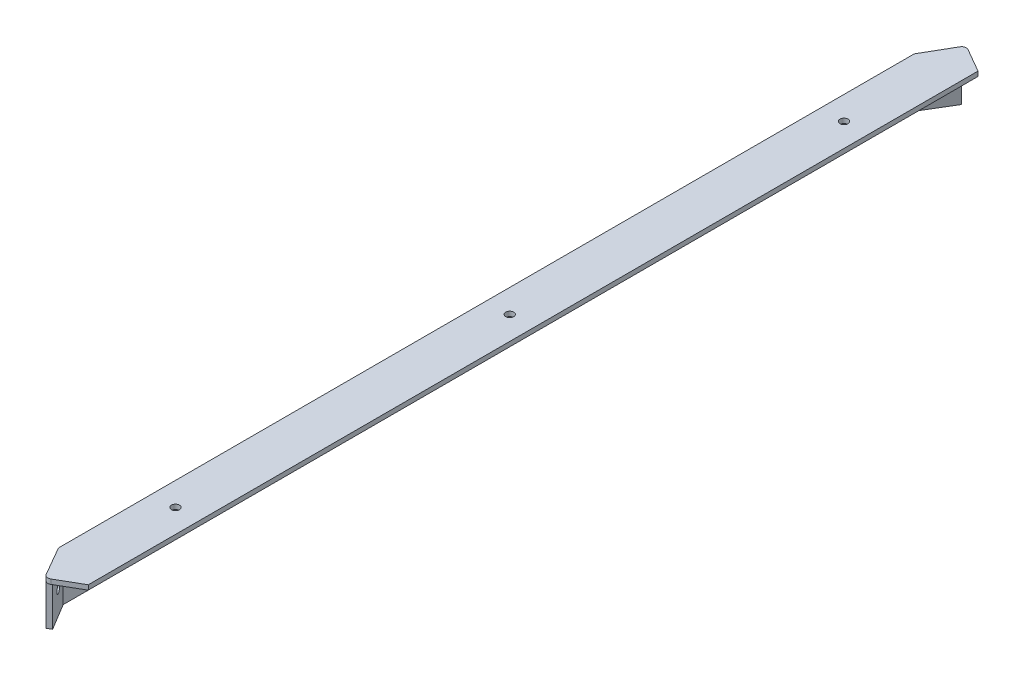
from build123d import *

# Parameters (mm, degrees)
BOSS_EXTRUDE1_DEPTH = 640
BOSS_EXTRUDE2_DEPTH = 63
BOSS_EXTRUDE4_DEPTH = 7
SKETCH10_R          = 6
CUT_EXTRUDE3_DEPTH  = 7
FILLET5_R           = 5
SKETCH22_R          = 6
CUT_EXTRUDE4_DEPTH  = 10


with BuildPart() as part:
    # Sketch1 → Boss-Extrude1 (new body)
    with BuildSketch(Plane.XY):
        Polygon((0, 0), (0, 70), (70, 70), (70, 63), (7, 63), (7, 0), align=None)
    extrude(amount=BOSS_EXTRUDE1_DEPTH)

    # Sketch2 → Boss-Extrude2 (add)
    with BuildSketch(Plane(origin=(0, 0, 0), x_dir=(1, 0, 0), z_dir=(0, 1, 0))):
        Polygon((0, -640), (25, -683.301270189), (31.062177826, -679.801270189), (7, -640), align=None)
    extrude(amount=BOSS_EXTRUDE2_DEPTH)

    # Sketch9 → Boss-Extrude4 (add)
    with BuildSketch(Plane(origin=(0, 63, 0), x_dir=(1, 0, 0), z_dir=(0, 1, 0))):
        with BuildLine():
            Line((0, -640), (25, -683.301270189))
            ThreePointArc((25, -683.301270189), (29.250444511, -686.562750973), (34.562177826, -685.863448016))
            Line((34.562177826, -685.863448016), (70, -665.403411844))
            Line((70, -665.403411844), (70, -640))
            Line((70, -640), (0, -640))
        make_face()
    extrude(amount=BOSS_EXTRUDE4_DEPTH)

    # Sketch10 → Cut-Extrude3 (cut)
    with BuildSketch(Plane(origin=(-278.227615862, 0, 168.20474164), x_dir=(-0.5173609804017633, 0, -0.8557672674026079), z_dir=(0.8557672674026079, 0, -0.5173609804017633))):
        with Locations((-572.82203414, 35)):
            Circle(SKETCH10_R)
    extrude(amount=-CUT_EXTRUDE3_DEPTH, mode=Mode.SUBTRACT)

    # Fillet5
    fillet5_edges = [part.edges().sort_by_distance(p)[0] for p in [
        (19.031088913, 63, 659.900635095),
        (7, 63, 320),
    ]]
    fillet(fillet5_edges, radius=FILLET5_R)

    # Mirror6: part across plane


with BuildPart() as part_1:
    add(part.part)
    add(part.part.mirror(Plane.XY))

    # Sketch22 → Cut-Extrude4 (cut)
    with BuildSketch(Plane(origin=(0, 70, 0), x_dir=(1, 0, 0), z_dir=(0, 1, 0))):
        with Locations((35, 0)):
            Circle(SKETCH22_R)
        with Locations((35, 500)):
            Circle(SKETCH22_R)
        with Locations((35, -500)):
            Circle(SKETCH22_R)
    extrude(amount=-CUT_EXTRUDE4_DEPTH, mode=Mode.SUBTRACT)


solid = part_1.part
